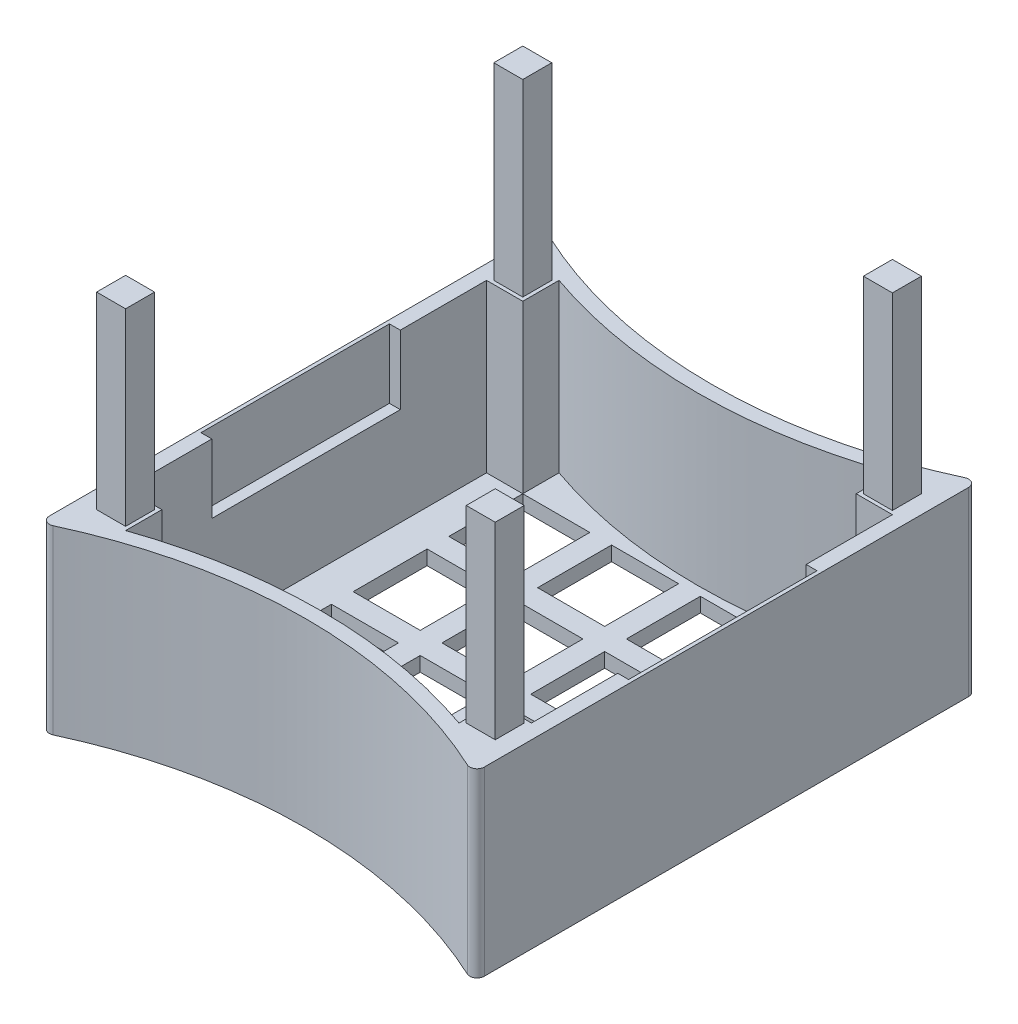
from build123d import *

# Parameters (mm, degrees)
RESSALTO_EXTRUS_O1_DEPTH = 25
CASCA1_T                 = -2
ESBO_O3_W                = 4
ESBO_O3_H                = 4
RESSALTO_EXTRUS_O2_DEPTH = 23
ESBO_O3_3_W              = 4
ESBO_O3_3_H              = 4
RESSALTO_EXTRUS_O3_DEPTH = 49
FILETE1_R                = 1
CORTE_EXTRUS_O1_START    = -0.5
ESBO_O4_W                = 26
ESBO_O4_H                = 9.5
ESBO_O4_H_2              = 3.5
CORTE_EXTRUS_O1_DEPTH    = 59
ESBO_O5_W                = 9.25
ESBO_O5_H                = 10.19955009
CORTE_EXTRUS_O2_DEPTH    = 10


with BuildPart() as part:
    # Esboço2 → Ressalto-extrusão1 (new body)
    with BuildSketch(Plane(origin=(0, 0, 0), x_dir=(1, 0, 0), z_dir=(0, 1, 0))):
        with BuildLine():
            Line((-30, 35), (-30, -35))
            ThreePointArc((-30, -35), (0, -28), (30, -35))
            Line((30, -35), (30, 35))
            ThreePointArc((30, 35), (0, 28), (-30, 35))
        make_face()
    extrude(amount=RESSALTO_EXTRUS_O1_DEPTH)

    # Casca1
    casca1_openings = [part.faces().sort_by_distance(p)[0] for p in [
        (0, 25, 0),
    ]]
    offset(amount=CASCA1_T, openings=casca1_openings, kind=Kind.INTERSECTION)

    # Esboço3 → Ressalto-extrusão2 (add)
    # profile 1 of 4: a face of its own
    with BuildSketch(Plane(origin=(0, 2, 0), x_dir=(1, 0, 0), z_dir=(0, 1, 0))):
        with BuildLine():
            Line((23, 24.89910018), (28, 24.89910018))
            Line((28, 24.89910018), (28, 31.863527853))
            ThreePointArc((28, 31.863527853), (25.518909538, 30.833184124), (23, 29.89910018))
            Line((23, 29.89910018), (23, 24.89910018))
        make_face()
        with Locations((25.5, 27.39910018)):
            Rectangle(ESBO_O3_W, ESBO_O3_H, mode=Mode.SUBTRACT)
    # profile 2 of 4: a face of its own
    with BuildSketch(Plane(origin=(0, 2, 0), x_dir=(1, 0, 0), z_dir=(0, 1, 0))):
        with BuildLine():
            Line((28, -31.863527853), (28, -24.89910018))
            Line((28, -24.89910018), (23, -24.89910018))
            Line((23, -24.89910018), (23, -29.89910018))
            ThreePointArc((23, -29.89910018), (25.518909538, -30.833184124), (28, -31.863527853))
        make_face()
        with Locations((25.5, -27.39910018)):
            Rectangle(ESBO_O3_W, ESBO_O3_H, mode=Mode.SUBTRACT)
    # profile 3 of 4: a face of its own
    with BuildSketch(Plane(origin=(0, 2, 0), x_dir=(1, 0, 0), z_dir=(0, 1, 0))):
        with BuildLine():
            Line((-23, 24.89910018), (-23, 29.89910018))
            ThreePointArc((-23, 29.89910018), (-25.518909538, 30.833184124), (-28, 31.863527853))
            Line((-28, 31.863527853), (-28, 24.89910018))
            Line((-28, 24.89910018), (-23, 24.89910018))
        make_face()
        with Locations((-25.5, 27.39910018)):
            Rectangle(ESBO_O3_W, ESBO_O3_H, mode=Mode.SUBTRACT)
    # profile 4 of 4: a face of its own
    with BuildSketch(Plane(origin=(0, 2, 0), x_dir=(1, 0, 0), z_dir=(0, 1, 0))):
        with BuildLine():
            ThreePointArc((-28, -31.863527853), (-25.518909538, -30.833184124), (-23, -29.89910018))
            Line((-23, -29.89910018), (-23, -24.89910018))
            Line((-23, -24.89910018), (-28, -24.89910018))
            Line((-28, -24.89910018), (-28, -31.863527853))
        make_face()
        with Locations((-25.5, -27.39910018)):
            Rectangle(ESBO_O3_W, ESBO_O3_H, mode=Mode.SUBTRACT)
    extrude(amount=RESSALTO_EXTRUS_O2_DEPTH)

    # Esboço3<3> → Ressalto-extrusão3 (add)
    with BuildSketch(Plane(origin=(0, 2, 0), x_dir=(1, 0, 0), z_dir=(0, 1, 0))):
        with Locations((25.5, 27.39910018)):
            Rectangle(ESBO_O3_3_W, ESBO_O3_3_H)
        with Locations((25.5, -27.39910018)):
            Rectangle(ESBO_O3_3_W, ESBO_O3_3_H)
        with Locations((-25.5, 27.39910018)):
            Rectangle(ESBO_O3_3_W, ESBO_O3_3_H)
        with Locations((-25.5, -27.39910018)):
            Rectangle(ESBO_O3_3_W, ESBO_O3_3_H)
    extrude(amount=RESSALTO_EXTRUS_O3_DEPTH)

    # Filete1
    filete1_edges = [part.edges().sort_by_distance(p)[0] for p in [
        (-30, 12.5, 35),
        (-30, 12.5, -35),
        (30, 12.5, -35),
        (30, 12.5, 35),
    ]]
    fillet(filete1_edges, radius=FILETE1_R)

    # Esboço4 → Corte-extrusão1 (cut)
    with BuildSketch(Plane(origin=(30, 0, 0), x_dir=(0, 0, -1), z_dir=(1, 0, 0)).offset(CORTE_EXTRUS_O1_START)):
        with Locations((0, 20.25)):
            Rectangle(ESBO_O4_W, ESBO_O4_H)
        with Locations((0, 26.75)):
            Rectangle(ESBO_O4_W, ESBO_O4_H_2)
    extrude(amount=-CORTE_EXTRUS_O1_DEPTH, mode=Mode.SUBTRACT)

    # Esboço5 → Corte-extrusão2 (cut)
    with BuildSketch(Plane(origin=(0, 2, 0), x_dir=(1, 0, 0), z_dir=(0, 1, 0))):
        with Locations((-18.375, 19.799325135)):
            Rectangle(ESBO_O5_W, ESBO_O5_H)
        Polygon((-13.75, 4.5), (-13.75, 11.69955009), (-23, 11.69955009), (-23, 4.5), (-23, 1.5), (-13.75, 1.5), align=None)
        with Locations((-6.125, 6.599775045)):
            Rectangle(ESBO_O5_W, ESBO_O5_H)
        Polygon((-10.75, 24.89910018), (-10.75, 14.69955009), (-4.5, 14.69955009), (-1.5, 14.69955009), (-1.5, 24.89910018), (-4.5, 24.89910018), align=None)
        Polygon((-23, -11.69955009), (-13.75, -11.69955009), (-13.75, -4.5), (-13.75, -1.5), (-23, -1.5), (-23, -4.5), align=None)
        with Locations((-6.125, -6.599775045)):
            Rectangle(ESBO_O5_W, ESBO_O5_H)
        with Locations((-18.375, -19.799325135)):
            Rectangle(ESBO_O5_W, ESBO_O5_H)
        Polygon((-1.5, -14.69955009), (-4.5, -14.69955009), (-10.75, -14.69955009), (-10.75, -24.89910018), (-4.5, -24.89910018), (-1.5, -24.89910018), align=None)
        Polygon((10.75, -14.69955009), (1.5, -14.69955009), (1.5, -24.89910018), (4.5, -24.89910018), (10.75, -24.89910018), align=None)
        with Locations((18.375, -19.799325135)):
            Rectangle(ESBO_O5_W, ESBO_O5_H)
        Polygon((13.75, -1.5), (13.75, -11.69955009), (23, -11.69955009), (23, -4.5), (23, -1.5), align=None)
        with Locations((6.125, -6.599775045)):
            Rectangle(ESBO_O5_W, ESBO_O5_H)
        with Locations((6.125, 6.599775045)):
            Rectangle(ESBO_O5_W, ESBO_O5_H)
        Polygon((13.75, 11.69955009), (13.75, 1.5), (23, 1.5), (23, 4.5), (23, 11.69955009), align=None)
        with Locations((18.375, 19.799325135)):
            Rectangle(ESBO_O5_W, ESBO_O5_H)
        Polygon((4.5, 14.69955009), (10.75, 14.69955009), (10.75, 24.89910018), (4.5, 24.89910018), (1.5, 24.89910018), (1.5, 14.69955009), align=None)
    extrude(amount=-CORTE_EXTRUS_O2_DEPTH, mode=Mode.SUBTRACT)


solid = part.part
